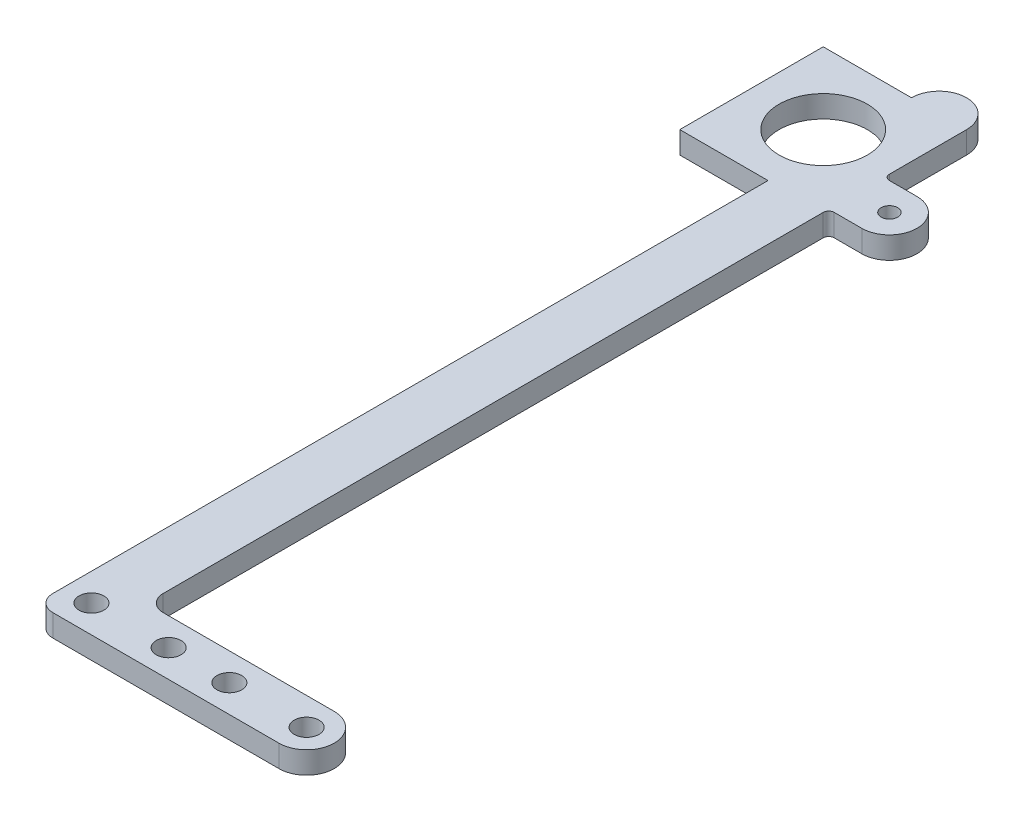
from build123d import *

# Parameters (mm, degrees)
BOSS_EXTRUDE1_DEPTH = 4
SKETCH2_R           = 2.25
BOSS_EXTRUDE2_DEPTH = 4
FILLET1_R           = 3
SKETCH5_R           = 1.5
BOSS_EXTRUDE4_DEPTH = 4
FILLET3_R           = 1
SKETCH7_W           = 16
SKETCH7_H           = 26
BOSS_EXTRUDE6_DEPTH = 4
SKETCH8_R           = 8
CUT_EXTRUDE1_DEPTH  = 4


with BuildPart() as part:
    # Sketch1 → Boss-Extrude1 (new body)
    with BuildSketch(Plane(origin=(0, 0, 0), x_dir=(1, 0, 0), z_dir=(0, 1, 0))):
        with BuildLine():
            ThreePointArc((10, 148.65), (5, 153.65), (0, 148.65))
            Line((0, 148.65), (0, 0))
            Line((0, 0), (10, 0))
            Line((10, 0), (10, 148.65))
        make_face()
    extrude(amount=BOSS_EXTRUDE1_DEPTH)

    # Sketch2 → Boss-Extrude2 (add)
    with BuildSketch(Plane(origin=(0, 4, 0), x_dir=(1, 0, 0), z_dir=(0, 1, 0))):
        with BuildLine():
            Line((44, 0), (10, 0))
            Line((10, 0), (0, 0))
            Line((0, 0), (0, -10))
            Line((0, -10), (44, -10))
            ThreePointArc((44, -10), (49, -5), (44, 0))
        make_face()
        with Locations((5, -5)):
            Circle(SKETCH2_R, mode=Mode.SUBTRACT)
        with Locations((19, -5)):
            Circle(SKETCH2_R, mode=Mode.SUBTRACT)
        with Locations((30, -5)):
            Circle(SKETCH2_R, mode=Mode.SUBTRACT)
        with Locations((44, -5)):
            Circle(SKETCH2_R, mode=Mode.SUBTRACT)
    extrude(amount=-BOSS_EXTRUDE2_DEPTH)

    # Fillet1
    fillet1_edges = [part.edges().sort_by_distance(p)[0] for p in [
        (10, 2, 0),
        (0, 2, 10),
    ]]
    fillet(fillet1_edges, radius=FILLET1_R)

    # Sketch5 → Boss-Extrude4 (add)
    with BuildSketch(Plane(origin=(0, 4, 0), x_dir=(1, 0, 0), z_dir=(0, 1, 0))):
        with BuildLine():
            ThreePointArc((16, 123.65), (21, 128.65), (16, 133.65))
            Line((16, 133.65), (10, 133.65))
            Line((10, 133.65), (10, 123.65))
            Line((10, 123.65), (16, 123.65))
        make_face()
        with Locations((16, 128.65)):
            Circle(SKETCH5_R, mode=Mode.SUBTRACT)
    extrude(amount=-BOSS_EXTRUDE4_DEPTH)

    # Fillet3
    fillet3_edges = [part.edges().sort_by_distance(p)[0] for p in [
        (10, 2, -123.65),
        (10, 2, -133.65),
    ]]
    fillet(fillet3_edges, radius=FILLET3_R)

    # Sketch7 → Boss-Extrude6 (add)
    with BuildSketch(Plane(origin=(0, 4, 0), x_dir=(1, 0, 0), z_dir=(0, 1, 0))):
        with Locations((-8, 135.65)):
            Rectangle(SKETCH7_W, SKETCH7_H)
    extrude(amount=-BOSS_EXTRUDE6_DEPTH)

    # Sketch8 → Cut-Extrude1 (cut)
    with BuildSketch(Plane(origin=(0, 4, 0), x_dir=(1, 0, 0), z_dir=(0, 1, 0))):
        with Locations((-3, 135.65)):
            Circle(SKETCH8_R)
    extrude(amount=-CUT_EXTRUDE1_DEPTH, mode=Mode.SUBTRACT)


solid = part.part
